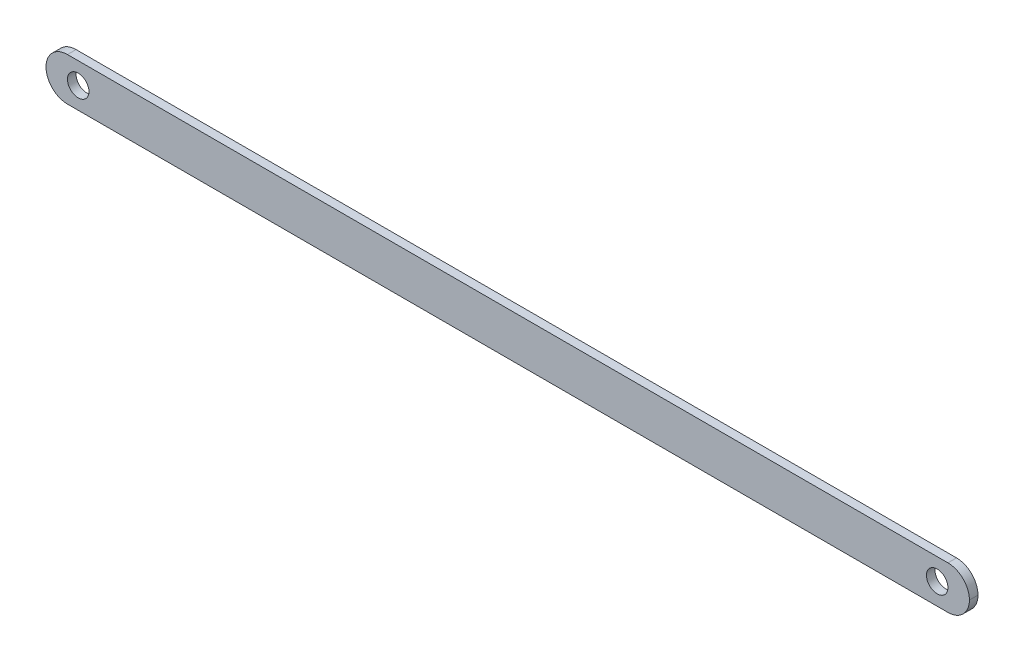
from build123d import *

# Parameters (mm, degrees)
SKETCH_1_W             = 215
SKETCH_1_H             = 10
SM_BASE_FLANGE_1_DEPTH = 2
SKETCH_6_R             = 2.5
CUT_EXTRUDE_1_DEPTH    = 108.634799205
FILLET_1_R             = 5


# Sheet-metal steps are written as plain solids
with BuildPart() as part:
    # Sketch 1 → Базовая кромка1 (new body)
    with BuildSketch(Plane.XY):
        Rectangle(SKETCH_1_W, SKETCH_1_H)
    extrude(amount=-SM_BASE_FLANGE_1_DEPTH)

    # Эскиз6 → Вырез-Вытянуть1 (cut, through all)
    with BuildSketch(Plane.XY):
        with Locations((100, 0)):
            Circle(SKETCH_6_R)
        with Locations(Location((-100, 0, 0), (0, 0, 180))):
            Circle(SKETCH_6_R)
    extrude(amount=-CUT_EXTRUDE_1_DEPTH, mode=Mode.SUBTRACT)

    # Скругление1
    fillet_1_edges = [part.edges().sort_by_distance(p)[0] for p in [
        (107.5, -5, -1),
        (107.5, 5, -1),
        (-107.5, -5, -1),
        (-107.5, 5, -1),
    ]]
    fillet(fillet_1_edges, radius=FILLET_1_R - 0.0001)  # a hair under: the kernel refuses the full size


solid = part.part
